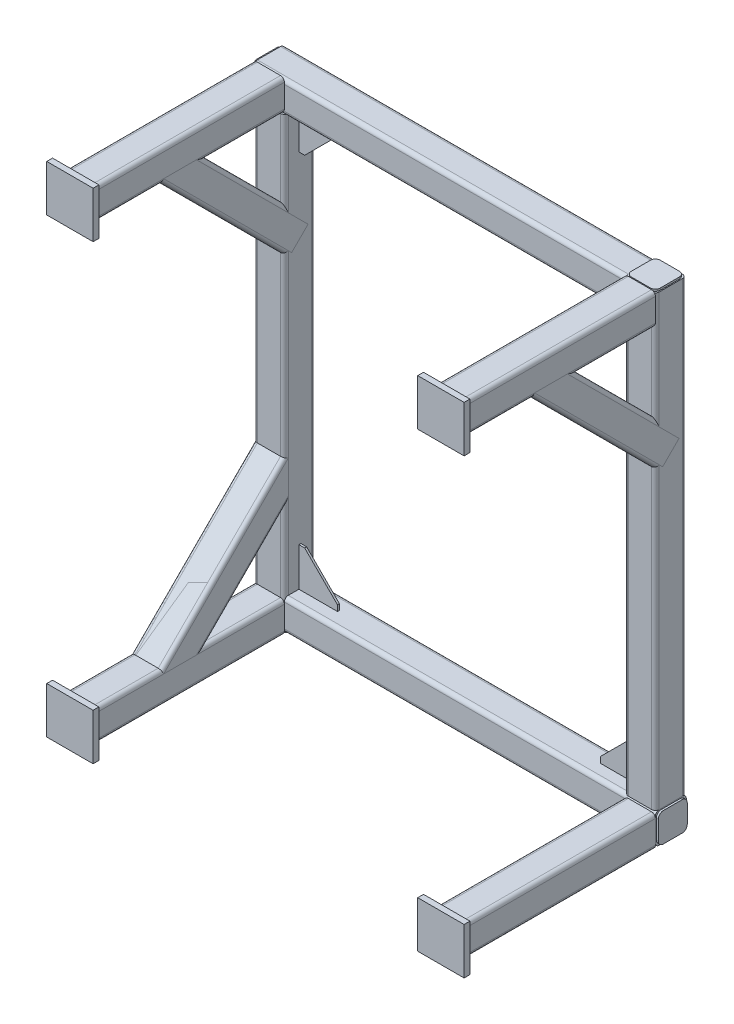
from build123d import *

# Parameters (mm, degrees)
SQUARE_TUBE_80_X_80_X_5_1_DEPTH      = 1200
SQUARE_TUBE_80_X_80_X_5_1_DEPTH_BACK = 1
SQUARE_TUBE_80_X_80_X_5_1_2_DEPTH    = 1001
SQUARE_TUBE_80_X_80_X_5_1_3_DEPTH    = 1201
SQUARE_TUBE_80_X_80_X_5_1_4_DEPTH    = 1001
END_START                            = -525
END_CAP1_DEPTH                       = 5
END_START_2                          = 520
END_CAP1_2_DEPTH                     = 5
END_START_3                          = -625
END_CAP1_3_DEPTH                     = 5
END_START_4                          = 620
END_CAP1_4_DEPTH                     = 5
SQUARE_TUBE_80_X_80_X_5_2_DEPTH      = 500
SQUARE_TUBE_80_X_80_X_5_2_2_DEPTH    = 500
SQUARE_TUBE_80_X_80_X_5_3_DEPTH      = 500
SQUARE_TUBE_80_X_80_X_5_3_2_DEPTH    = 500
SQUARE_TUBE_80_X_80_X_5_4_DEPTH      = 480.832611207
SQUARE_TUBE_80_X_80_X_5_4_2_DEPTH    = 480.832611207
SQUARE_TUBE_80_X_80_X_5_5_DEPTH      = 480.832611207
SQUARE_TUBE_80_X_80_X_5_5_2_DEPTH    = 480.832611207
SKETCH20_W                           = 120
SKETCH20_H                           = 120
BOSS_EXTRUDE1_DEPTH                  = 15
BOSS_EXTRUDE1_2_DEPTH                = 15
BOSS_EXTRUDE1_3_DEPTH                = 15
BOSS_EXTRUDE1_4_DEPTH                = 15
GUSSET1_THICKNESS                    = 5
GUSSET2_THICKNESS                    = 5
GUSSET3_THICKNESS                    = 5
GUSSET4_THICKNESS                    = 5


# Read off the part's stored shape, not the designer's step: End cap1
with BuildPart() as part:
    # Sketch11 → Square tube 80 X 80 X 5(1) (new, two sides: drawn at the far end of the back side and taken through both)
    with BuildSketch(Plane(origin=(-480, 580, 0), x_dir=(1, 0, 0), z_dir=(0, -1, 0)).offset(-SQUARE_TUBE_80_X_80_X_5_1_DEPTH_BACK)):
        with BuildLine():
            Line((-30, -40), (30, -40))
            ThreePointArc((30, -40), (37.071067812, -37.071067812), (40, -30))
            Line((40, -30), (40, 30))
            ThreePointArc((40, 30), (37.071067812, 37.071067812), (30, 40))
            Line((30, 40), (-30, 40))
            ThreePointArc((-30, 40), (-37.071067812, 37.071067812), (-40, 30))
            Line((-40, 30), (-40, -30))
            ThreePointArc((-40, -30), (-37.071067812, -37.071067812), (-30, -40))
        make_face()
        with BuildLine():
            Line((-30, -35), (30, -35))
            ThreePointArc((30, -35), (33.535533906, -33.535533906), (35, -30))
            Line((35, -30), (35, 30))
            ThreePointArc((35, 30), (33.535533906, 33.535533906), (30, 35))
            Line((30, 35), (-30, 35))
            ThreePointArc((-30, 35), (-33.535533906, 33.535533906), (-35, 30))
            Line((-35, 30), (-35, -30))
            ThreePointArc((-35, -30), (-33.535533906, -33.535533906), (-30, -35))
        make_face(mode=Mode.SUBTRACT)
    extrude(amount=SQUARE_TUBE_80_X_80_X_5_1_DEPTH + SQUARE_TUBE_80_X_80_X_5_1_DEPTH_BACK)

    # Square tube 80 X 80 X 5(1) end butt 1
    split(bisect_by=Plane(origin=(-480, 540, 0), x_dir=(1, 0, 0), z_dir=(0, -1, 0)), keep=Keep.TOP)


with BuildPart() as body_2:
    # Sketch11 on segment 2 (carried to segment 2) → Square tube 80 X 80 X 5_1 2 (new body)
    with BuildSketch(Plane(origin=(-481, -580, 0), x_dir=(0, 1, 0), z_dir=(1, 0, 0))):
        with BuildLine():
            Line((-30, -40), (30, -40))
            ThreePointArc((30, -40), (37.071067812, -37.071067812), (40, -30))
            Line((40, -30), (40, 30))
            ThreePointArc((40, 30), (37.071067812, 37.071067812), (30, 40))
            Line((30, 40), (-30, 40))
            ThreePointArc((-30, 40), (-37.071067812, 37.071067812), (-40, 30))
            Line((-40, 30), (-40, -30))
            ThreePointArc((-40, -30), (-37.071067812, -37.071067812), (-30, -40))
        make_face()
        with BuildLine():
            Line((-30, -35), (30, -35))
            ThreePointArc((30, -35), (33.535533906, -33.535533906), (35, -30))
            Line((35, -30), (35, 30))
            ThreePointArc((35, 30), (33.535533906, 33.535533906), (30, 35))
            Line((30, 35), (-30, 35))
            ThreePointArc((-30, 35), (-33.535533906, 33.535533906), (-35, 30))
            Line((-35, 30), (-35, -30))
            ThreePointArc((-35, -30), (-33.535533906, -33.535533906), (-30, -35))
        make_face(mode=Mode.SUBTRACT)
    extrude(amount=SQUARE_TUBE_80_X_80_X_5_1_2_DEPTH)

    # Square tube 80 X 80 X 5_1 2 end butt 1
    split(bisect_by=Plane(origin=(-440, -580, 0), x_dir=(0, 1, 0), z_dir=(1, 0, 0)), keep=Keep.TOP)


with BuildPart() as body_3:
    # Sketch11 on segment 3 (carried to segment 3) → Square tube 80 X 80 X 5_1 3 (new body)
    with BuildSketch(Plane(origin=(480, -581, 0), x_dir=(-1, 0, 0), z_dir=(0, 1, 0))):
        with BuildLine():
            Line((-30, -40), (30, -40))
            ThreePointArc((30, -40), (37.071067812, -37.071067812), (40, -30))
            Line((40, -30), (40, 30))
            ThreePointArc((40, 30), (37.071067812, 37.071067812), (30, 40))
            Line((30, 40), (-30, 40))
            ThreePointArc((-30, 40), (-37.071067812, 37.071067812), (-40, 30))
            Line((-40, 30), (-40, -30))
            ThreePointArc((-40, -30), (-37.071067812, -37.071067812), (-30, -40))
        make_face()
        with BuildLine():
            Line((-30, -35), (30, -35))
            ThreePointArc((30, -35), (33.535533906, -33.535533906), (35, -30))
            Line((35, -30), (35, 30))
            ThreePointArc((35, 30), (33.535533906, 33.535533906), (30, 35))
            Line((30, 35), (-30, 35))
            ThreePointArc((-30, 35), (-33.535533906, 33.535533906), (-35, 30))
            Line((-35, 30), (-35, -30))
            ThreePointArc((-35, -30), (-33.535533906, -33.535533906), (-30, -35))
        make_face(mode=Mode.SUBTRACT)
    extrude(amount=SQUARE_TUBE_80_X_80_X_5_1_3_DEPTH)

    # Square tube 80 X 80 X 5_1 3 end butt 1
    split(bisect_by=Plane(origin=(480, -540, 0), x_dir=(-1, 0, 0), z_dir=(0, 1, 0)), keep=Keep.TOP)


with BuildPart() as body_4:
    # Sketch11 on segment 4 (carried to segment 4) → Square tube 80 X 80 X 5_1 4 (new body)
    with BuildSketch(Plane(origin=(481, 580, 0), x_dir=(0, -1, 0), z_dir=(-1, 0, 0))):
        with BuildLine():
            Line((-30, -40), (30, -40))
            ThreePointArc((30, -40), (37.071067812, -37.071067812), (40, -30))
            Line((40, -30), (40, 30))
            ThreePointArc((40, 30), (37.071067812, 37.071067812), (30, 40))
            Line((30, 40), (-30, 40))
            ThreePointArc((-30, 40), (-37.071067812, 37.071067812), (-40, 30))
            Line((-40, 30), (-40, -30))
            ThreePointArc((-40, -30), (-37.071067812, -37.071067812), (-30, -40))
        make_face()
        with BuildLine():
            Line((-30, -35), (30, -35))
            ThreePointArc((30, -35), (33.535533906, -33.535533906), (35, -30))
            Line((35, -30), (35, 30))
            ThreePointArc((35, 30), (33.535533906, 33.535533906), (30, 35))
            Line((30, 35), (-30, 35))
            ThreePointArc((-30, 35), (-33.535533906, 33.535533906), (-35, 30))
            Line((-35, 30), (-35, -30))
            ThreePointArc((-35, -30), (-33.535533906, -33.535533906), (-30, -35))
        make_face(mode=Mode.SUBTRACT)
    extrude(amount=SQUARE_TUBE_80_X_80_X_5_1_4_DEPTH)

    # Square tube 80 X 80 X 5_1 4 end butt 1
    split(bisect_by=Plane(origin=(440, 580, 0), x_dir=(0, -1, 0), z_dir=(-1, 0, 0)), keep=Keep.TOP)


with BuildPart() as body_5:
    # End cap1 outline → End cap1 (new body)
    with BuildSketch(Plane.YZ.offset(END_START)):
        with BuildLine():
            Line((604.5, 37.5), (555.5, 37.5))
            ThreePointArc((555.5, 37.5), (546.307611845, 33.692388155), (542.5, 24.5))
            Line((542.5, 24.5), (542.5, -24.5))
            ThreePointArc((542.5, -24.5), (546.307611845, -33.692388155), (555.5, -37.5))
            Line((555.5, -37.5), (604.5, -37.5))
            ThreePointArc((604.5, -37.5), (613.692388155, -33.692388155), (617.5, -24.5))
            Line((617.5, -24.5), (617.5, 24.5))
            ThreePointArc((617.5, 24.5), (613.692388155, 33.692388155), (604.5, 37.5))
        make_face()
    extrude(amount=END_CAP1_DEPTH)


with BuildPart() as body_6:
    # End cap1 2 outline → End cap1 2 (new body)
    with BuildSketch(Plane.YZ.offset(END_START_2)):
        with BuildLine():
            Line((-555.5, 37.5), (-604.5, 37.5))
            ThreePointArc((-604.5, 37.5), (-613.692388155, 33.692388155), (-617.5, 24.5))
            Line((-617.5, 24.5), (-617.5, -24.5))
            ThreePointArc((-617.5, -24.5), (-613.692388155, -33.692388155), (-604.5, -37.5))
            Line((-604.5, -37.5), (-555.5, -37.5))
            ThreePointArc((-555.5, -37.5), (-546.307611845, -33.692388155), (-542.5, -24.5))
            Line((-542.5, -24.5), (-542.5, 24.5))
            ThreePointArc((-542.5, 24.5), (-546.307611845, 33.692388155), (-555.5, 37.5))
        make_face()
    extrude(amount=END_CAP1_2_DEPTH)


with BuildPart() as body_7:
    # End cap1 3 outline → End cap1 3 (new body)
    with BuildSketch(Plane(origin=(0, 0, 0), x_dir=(1, 0, 0), z_dir=(0, 1, 0)).offset(END_START_3)):
        with BuildLine():
            Line((-504.5, -37.5), (-455.5, -37.5))
            ThreePointArc((-455.5, -37.5), (-446.307611845, -33.692388155), (-442.5, -24.5))
            Line((-442.5, -24.5), (-442.5, 24.5))
            ThreePointArc((-442.5, 24.5), (-446.307611845, 33.692388155), (-455.5, 37.5))
            Line((-455.5, 37.5), (-504.5, 37.5))
            ThreePointArc((-504.5, 37.5), (-513.692388155, 33.692388155), (-517.5, 24.5))
            Line((-517.5, 24.5), (-517.5, -24.5))
            ThreePointArc((-517.5, -24.5), (-513.692388155, -33.692388155), (-504.5, -37.5))
        make_face()
    extrude(amount=END_CAP1_3_DEPTH)


with BuildPart() as body_8:
    # End cap1 4 outline → End cap1 4 (new body)
    with BuildSketch(Plane(origin=(0, 0, 0), x_dir=(1, 0, 0), z_dir=(0, 1, 0)).offset(END_START_4)):
        with BuildLine():
            Line((455.5, -37.5), (504.5, -37.5))
            ThreePointArc((504.5, -37.5), (513.692388155, -33.692388155), (517.5, -24.5))
            Line((517.5, -24.5), (517.5, 24.5))
            ThreePointArc((517.5, 24.5), (513.692388155, 33.692388155), (504.5, 37.5))
            Line((504.5, 37.5), (455.5, 37.5))
            ThreePointArc((455.5, 37.5), (446.307611845, 33.692388155), (442.5, 24.5))
            Line((442.5, 24.5), (442.5, -24.5))
            ThreePointArc((442.5, -24.5), (446.307611845, -33.692388155), (455.5, -37.5))
        make_face()
    extrude(amount=END_CAP1_4_DEPTH)


with BuildPart() as body_9:
    # Sketch12 → Square tube 80 X 80 X 5(2) (new body)
    with BuildSketch(Plane(origin=(480, 585, 40), x_dir=(0, -1, 0), z_dir=(0, 0, 1))):
        with BuildLine():
            Line((-30, -40), (30, -40))
            ThreePointArc((30, -40), (37.071067812, -37.071067812), (40, -30))
            Line((40, -30), (40, 30))
            ThreePointArc((40, 30), (37.071067812, 37.071067812), (30, 40))
            Line((30, 40), (-30, 40))
            ThreePointArc((-30, 40), (-37.071067812, 37.071067812), (-40, 30))
            Line((-40, 30), (-40, -30))
            ThreePointArc((-40, -30), (-37.071067812, -37.071067812), (-30, -40))
        make_face()
        with BuildLine():
            Line((-30, -35), (30, -35))
            ThreePointArc((30, -35), (33.535533906, -33.535533906), (35, -30))
            Line((35, -30), (35, 30))
            ThreePointArc((35, 30), (33.535533906, 33.535533906), (30, 35))
            Line((30, 35), (-30, 35))
            ThreePointArc((-30, 35), (-33.535533906, 33.535533906), (-35, 30))
            Line((-35, 30), (-35, -30))
            ThreePointArc((-35, -30), (-33.535533906, -33.535533906), (-30, -35))
        make_face(mode=Mode.SUBTRACT)
    extrude(amount=SQUARE_TUBE_80_X_80_X_5_2_DEPTH)


with BuildPart() as body_10:
    # Sketch12 on segment 2 (carried to segment 2) → Square tube 80 X 80 X 5_2 2 (new body)
    with BuildSketch(Plane(origin=(480, -585, 40), x_dir=(0, -1, 0), z_dir=(0, 0, 1))):
        with BuildLine():
            Line((-30, -40), (30, -40))
            ThreePointArc((30, -40), (37.071067812, -37.071067812), (40, -30))
            Line((40, -30), (40, 30))
            ThreePointArc((40, 30), (37.071067812, 37.071067812), (30, 40))
            Line((30, 40), (-30, 40))
            ThreePointArc((-30, 40), (-37.071067812, 37.071067812), (-40, 30))
            Line((-40, 30), (-40, -30))
            ThreePointArc((-40, -30), (-37.071067812, -37.071067812), (-30, -40))
        make_face()
        with BuildLine():
            Line((-30, -35), (30, -35))
            ThreePointArc((30, -35), (33.535533906, -33.535533906), (35, -30))
            Line((35, -30), (35, 30))
            ThreePointArc((35, 30), (33.535533906, 33.535533906), (30, 35))
            Line((30, 35), (-30, 35))
            ThreePointArc((-30, 35), (-33.535533906, 33.535533906), (-35, 30))
            Line((-35, 30), (-35, -30))
            ThreePointArc((-35, -30), (-33.535533906, -33.535533906), (-30, -35))
        make_face(mode=Mode.SUBTRACT)
    extrude(amount=SQUARE_TUBE_80_X_80_X_5_2_2_DEPTH)


with BuildPart() as body_11:
    # Sketch13 → Square tube 80 X 80 X 5(3) (new body)
    with BuildSketch(Plane(origin=(-480, -585, 40), x_dir=(0, 1, 0), z_dir=(0, 0, 1))):
        with BuildLine():
            Line((-30, -40), (30, -40))
            ThreePointArc((30, -40), (37.071067812, -37.071067812), (40, -30))
            Line((40, -30), (40, 30))
            ThreePointArc((40, 30), (37.071067812, 37.071067812), (30, 40))
            Line((30, 40), (-30, 40))
            ThreePointArc((-30, 40), (-37.071067812, 37.071067812), (-40, 30))
            Line((-40, 30), (-40, -30))
            ThreePointArc((-40, -30), (-37.071067812, -37.071067812), (-30, -40))
        make_face()
        with BuildLine():
            Line((-30, -35), (30, -35))
            ThreePointArc((30, -35), (33.535533906, -33.535533906), (35, -30))
            Line((35, -30), (35, 30))
            ThreePointArc((35, 30), (33.535533906, 33.535533906), (30, 35))
            Line((30, 35), (-30, 35))
            ThreePointArc((-30, 35), (-33.535533906, 33.535533906), (-35, 30))
            Line((-35, 30), (-35, -30))
            ThreePointArc((-35, -30), (-33.535533906, -33.535533906), (-30, -35))
        make_face(mode=Mode.SUBTRACT)
    extrude(amount=SQUARE_TUBE_80_X_80_X_5_3_DEPTH)


with BuildPart() as body_12:
    # Sketch13 on segment 2 (carried to segment 2) → Square tube 80 X 80 X 5_3 2 (new body)
    with BuildSketch(Plane(origin=(-480, 585, 40), x_dir=(0, 1, 0), z_dir=(0, 0, 1))):
        with BuildLine():
            Line((-30, -40), (30, -40))
            ThreePointArc((30, -40), (37.071067812, -37.071067812), (40, -30))
            Line((40, -30), (40, 30))
            ThreePointArc((40, 30), (37.071067812, 37.071067812), (30, 40))
            Line((30, 40), (-30, 40))
            ThreePointArc((-30, 40), (-37.071067812, 37.071067812), (-40, 30))
            Line((-40, 30), (-40, -30))
            ThreePointArc((-40, -30), (-37.071067812, -37.071067812), (-30, -40))
        make_face()
        with BuildLine():
            Line((-30, -35), (30, -35))
            ThreePointArc((30, -35), (33.535533906, -33.535533906), (35, -30))
            Line((35, -30), (35, 30))
            ThreePointArc((35, 30), (33.535533906, 33.535533906), (30, 35))
            Line((30, 35), (-30, 35))
            ThreePointArc((-30, 35), (-33.535533906, 33.535533906), (-35, 30))
            Line((-35, 30), (-35, -30))
            ThreePointArc((-35, -30), (-33.535533906, -33.535533906), (-30, -35))
        make_face(mode=Mode.SUBTRACT)
    extrude(amount=SQUARE_TUBE_80_X_80_X_5_3_2_DEPTH)


with BuildPart() as body_13:
    # Sketch14 → Square tube 80 X 80 X 5(4) (new body)
    with BuildSketch(Plane(origin=(-480, -245, 0), x_dir=(0, 0.7071067811865462, 0.7071067811865488), z_dir=(0, -0.7071067811865488, 0.7071067811865462))):
        with BuildLine():
            Line((-30, -40), (30, -40))
            ThreePointArc((30, -40), (37.071067812, -37.071067812), (40, -30))
            Line((40, -30), (40, 30))
            ThreePointArc((40, 30), (37.071067812, 37.071067812), (30, 40))
            Line((30, 40), (-30, 40))
            ThreePointArc((-30, 40), (-37.071067812, 37.071067812), (-40, 30))
            Line((-40, 30), (-40, -30))
            ThreePointArc((-40, -30), (-37.071067812, -37.071067812), (-30, -40))
        make_face()
        with BuildLine():
            Line((-30, -35), (30, -35))
            ThreePointArc((30, -35), (33.535533906, -33.535533906), (35, -30))
            Line((35, -30), (35, 30))
            ThreePointArc((35, 30), (33.535533906, 33.535533906), (30, 35))
            Line((30, 35), (-30, 35))
            ThreePointArc((-30, 35), (-33.535533906, 33.535533906), (-35, 30))
            Line((-35, 30), (-35, -30))
            ThreePointArc((-35, -30), (-33.535533906, -33.535533906), (-30, -35))
        make_face(mode=Mode.SUBTRACT)
    extrude(amount=SQUARE_TUBE_80_X_80_X_5_4_DEPTH)


with BuildPart() as body_14:
    # Sketch14 on segment 2 (carried to segment 2) → Square tube 80 X 80 X 5_4 2 (new body)
    with BuildSketch(Plane(origin=(-480, 245, 0), x_dir=(0, 0.707106781, -0.707106781), z_dir=(0, 0.707106781, 0.707106781))):
        with BuildLine():
            Line((-30, -40), (30, -40))
            ThreePointArc((30, -40), (37.071067812, -37.071067812), (40, -30))
            Line((40, -30), (40, 30))
            ThreePointArc((40, 30), (37.071067812, 37.071067812), (30, 40))
            Line((30, 40), (-30, 40))
            ThreePointArc((-30, 40), (-37.071067812, 37.071067812), (-40, 30))
            Line((-40, 30), (-40, -30))
            ThreePointArc((-40, -30), (-37.071067812, -37.071067812), (-30, -40))
        make_face()
        with BuildLine():
            Line((-30, -35), (30, -35))
            ThreePointArc((30, -35), (33.535533906, -33.535533906), (35, -30))
            Line((35, -30), (35, 30))
            ThreePointArc((35, 30), (33.535533906, 33.535533906), (30, 35))
            Line((30, 35), (-30, 35))
            ThreePointArc((-30, 35), (-33.535533906, 33.535533906), (-35, 30))
            Line((-35, 30), (-35, -30))
            ThreePointArc((-35, -30), (-33.535533906, -33.535533906), (-30, -35))
        make_face(mode=Mode.SUBTRACT)
    extrude(amount=SQUARE_TUBE_80_X_80_X_5_4_2_DEPTH)


with BuildPart() as body_15:
    # Sketch16 → Square tube 80 X 80 X 5(5) (new body)
    with BuildSketch(Plane(origin=(480, 245, 0), x_dir=(0, -0.7071067811865461, 0.7071067811865491), z_dir=(0, 0.7071067811865491, 0.7071067811865461))):
        with BuildLine():
            Line((-30, -40), (30, -40))
            ThreePointArc((30, -40), (37.071067812, -37.071067812), (40, -30))
            Line((40, -30), (40, 30))
            ThreePointArc((40, 30), (37.071067812, 37.071067812), (30, 40))
            Line((30, 40), (-30, 40))
            ThreePointArc((-30, 40), (-37.071067812, 37.071067812), (-40, 30))
            Line((-40, 30), (-40, -30))
            ThreePointArc((-40, -30), (-37.071067812, -37.071067812), (-30, -40))
        make_face()
        with BuildLine():
            Line((-30, -35), (30, -35))
            ThreePointArc((30, -35), (33.535533906, -33.535533906), (35, -30))
            Line((35, -30), (35, 30))
            ThreePointArc((35, 30), (33.535533906, 33.535533906), (30, 35))
            Line((30, 35), (-30, 35))
            ThreePointArc((-30, 35), (-33.535533906, 33.535533906), (-35, 30))
            Line((-35, 30), (-35, -30))
            ThreePointArc((-35, -30), (-33.535533906, -33.535533906), (-30, -35))
        make_face(mode=Mode.SUBTRACT)
    extrude(amount=SQUARE_TUBE_80_X_80_X_5_5_DEPTH)


with BuildPart() as body_16:
    # Sketch16 on segment 2 (carried to segment 2) → Square tube 80 X 80 X 5_5 2 (new body)
    with BuildSketch(Plane(origin=(-480, -245, 0), x_dir=(0, -0.707106781, -0.707106781), z_dir=(0, -0.707106781, 0.707106781))):
        with BuildLine():
            Line((-30, -40), (30, -40))
            ThreePointArc((30, -40), (37.071067812, -37.071067812), (40, -30))
            Line((40, -30), (40, 30))
            ThreePointArc((40, 30), (37.071067812, 37.071067812), (30, 40))
            Line((30, 40), (-30, 40))
            ThreePointArc((-30, 40), (-37.071067812, 37.071067812), (-40, 30))
            Line((-40, 30), (-40, -30))
            ThreePointArc((-40, -30), (-37.071067812, -37.071067812), (-30, -40))
        make_face()
        with BuildLine():
            Line((-30, -35), (30, -35))
            ThreePointArc((30, -35), (33.535533906, -33.535533906), (35, -30))
            Line((35, -30), (35, 30))
            ThreePointArc((35, 30), (33.535533906, 33.535533906), (30, 35))
            Line((30, 35), (-30, 35))
            ThreePointArc((-30, 35), (-33.535533906, 33.535533906), (-35, 30))
            Line((-35, 30), (-35, -30))
            ThreePointArc((-35, -30), (-33.535533906, -33.535533906), (-30, -35))
        make_face(mode=Mode.SUBTRACT)
    extrude(amount=SQUARE_TUBE_80_X_80_X_5_5_2_DEPTH)


with BuildPart() as body_17:
    # Sketch20 → Boss-Extrude1 (new body)
    with BuildSketch(Plane.XY.offset(540)):
        with Locations((-480, 585)):
            Rectangle(SKETCH20_W, SKETCH20_H)
    extrude(amount=BOSS_EXTRUDE1_DEPTH)


with BuildPart() as body_18:
    # Sketch20 → Boss-Extrude1 2 (new body)
    with BuildSketch(Plane.XY.offset(540)):
        with Locations((-480, -585)):
            Rectangle(SKETCH20_W, SKETCH20_H)
    extrude(amount=BOSS_EXTRUDE1_2_DEPTH)


with BuildPart() as body_19:
    # Sketch20 → Boss-Extrude1 3 (new body)
    with BuildSketch(Plane.XY.offset(540)):
        with Locations((480, -585)):
            Rectangle(SKETCH20_W, SKETCH20_H)
    extrude(amount=BOSS_EXTRUDE1_3_DEPTH)


with BuildPart() as body_20:
    # Sketch20 → Boss-Extrude1 4 (new body)
    with BuildSketch(Plane.XY.offset(540)):
        with Locations((480, 585)):
            Rectangle(SKETCH20_W, SKETCH20_H)
    extrude(amount=BOSS_EXTRUDE1_4_DEPTH)


with BuildPart() as body_21:
    # Gusset1: a gusset: a plate 5.0 thick in the corner of two members, its outline drawn in place
    gusset1_outline = Wire([Line((-440, -540, -2.5), (-440, -440, -2.5)), Line((-440, -440, -2.5), (-425, -440, -2.5)), Line((-425, -440, -2.5), (-340, -525, -2.5)), Line((-340, -525, -2.5), (-340, -540, -2.5)), Line((-340, -540, -2.5), (-440, -540, -2.5))])
    add(extrude(Face(gusset1_outline), amount=GUSSET1_THICKNESS, dir=(0, 0, 1)))


with BuildPart() as body_22:
    # Gusset2: a gusset: a plate 5.0 thick in the corner of two members, its outline drawn in place
    gusset2_outline = Wire([Line((440, -540, 2.5), (440, -440, 2.5)), Line((440, -440, 2.5), (425, -440, 2.5)), Line((425, -440, 2.5), (340, -525, 2.5)), Line((340, -525, 2.5), (340, -540, 2.5)), Line((340, -540, 2.5), (440, -540, 2.5))])
    add(extrude(Face(gusset2_outline), amount=GUSSET2_THICKNESS, dir=(0, 0, -1)))


with BuildPart() as body_23:
    # Gusset3: a gusset: a plate 5.0 thick in the corner of two members, its outline drawn in place
    gusset3_outline = Wire([Line((440, 540, -2.5), (440, 440, -2.5)), Line((440, 440, -2.5), (425, 440, -2.5)), Line((425, 440, -2.5), (340, 525, -2.5)), Line((340, 525, -2.5), (340, 540, -2.5)), Line((340, 540, -2.5), (440, 540, -2.5))])
    add(extrude(Face(gusset3_outline), amount=GUSSET3_THICKNESS, dir=(0, 0, 1)))


with BuildPart() as body_24:
    # Gusset4: a gusset: a plate 5.0 thick in the corner of two members, its outline drawn in place
    gusset4_outline = Wire([Line((-440, 540, 2.5), (-440, 440, 2.5)), Line((-440, 440, 2.5), (-425, 440, 2.5)), Line((-425, 440, 2.5), (-340, 525, 2.5)), Line((-340, 525, 2.5), (-340, 540, 2.5)), Line((-340, 540, 2.5), (-440, 540, 2.5))])
    add(extrude(Face(gusset4_outline), amount=GUSSET4_THICKNESS, dir=(0, 0, -1)))


solid = Compound([part.part, body_2.part, body_3.part, body_4.part, body_5.part, body_6.part, body_7.part, body_8.part, body_9.part, body_10.part, body_11.part, body_12.part, body_13.part, body_14.part, body_15.part, body_16.part, body_17.part, body_18.part, body_19.part, body_20.part, body_21.part, body_22.part, body_23.part, body_24.part])
